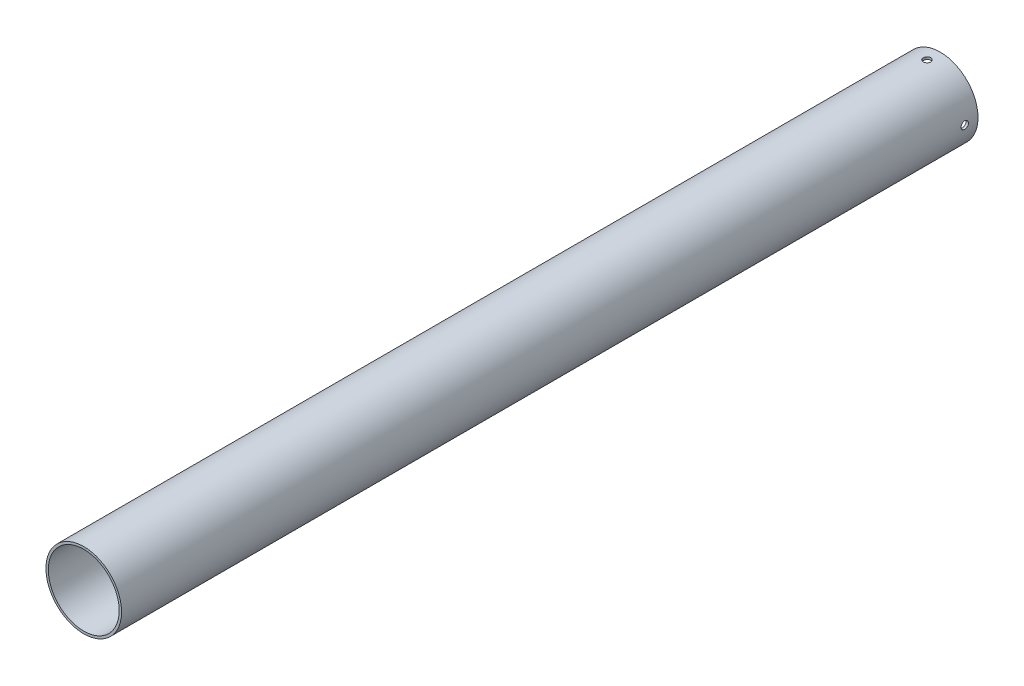
from build123d import *

# Parameters (mm, degrees)
SKETCH1_R               = 25.4
SKETCH1_R_2             = 23.8125
BOSS_EXTRUDE1_DEPTH     = 287.606496287
CUT_EXTRUDE1_DEPTH      = 290.84101971
CUT_EXTRUDE1_DEPTH_BACK = 290.84101971
SKETCH2_R               = 2.4892
CUT_EXTRUDE2_DEPTH      = 290.841019827
CUT_EXTRUDE2_DEPTH_BACK = 290.841019827
SKETCH3_R               = 2.4892


with BuildPart() as part:
    # Sketch1 → Boss-Extrude1 (new, symmetric)
    with BuildSketch(Plane.XY):
        Circle(SKETCH1_R)
        Circle(SKETCH1_R_2, mode=Mode.SUBTRACT)
    extrude(amount=BOSS_EXTRUDE1_DEPTH, both=True)

    # Sketch2 → Cut-Extrude1 (cut, two sides: drawn at the far end of the back side and taken through both)
    with BuildSketch(Plane(origin=(0, 0, 0), x_dir=(0, 0, -1), z_dir=(1, 0, 0)).offset(-CUT_EXTRUDE1_DEPTH_BACK)):
        with Locations((278.716496287, 0)):
            Circle(SKETCH2_R)
    extrude(amount=CUT_EXTRUDE1_DEPTH + CUT_EXTRUDE1_DEPTH_BACK, mode=Mode.SUBTRACT)

    # Sketch3 → Cut-Extrude2 (cut, two sides: drawn at the far end of the back side and taken through both)
    with BuildSketch(Plane(origin=(0, 0, 0), x_dir=(1, 0, 0), z_dir=(0, 1, 0)).offset(-CUT_EXTRUDE2_DEPTH_BACK)):
        with Locations((0, 278.716496287)):
            Circle(SKETCH3_R)
    extrude(amount=CUT_EXTRUDE2_DEPTH + CUT_EXTRUDE2_DEPTH_BACK, mode=Mode.SUBTRACT)


solid = part.part
